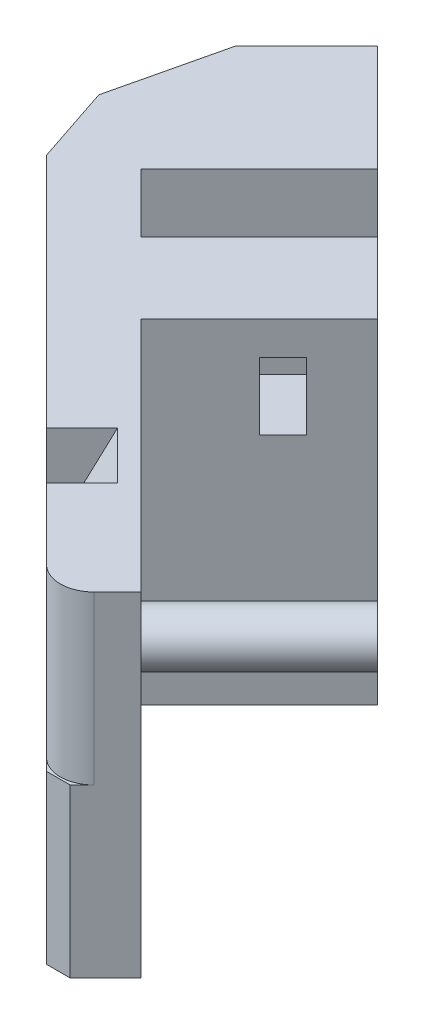
from build123d import *

# Parameters (mm, degrees)
SKICA1_W                 = 200
SKICA1_H                 = 100
P_IDAT_VYSUNUT_M1_DEPTH  = 20
P_IDAT_VYSUNUT_M2_DEPTH  = 50
SKICA7_R                 = 7.5
P_IDAT_VYSUNUT_M3_DEPTH  = 50
ODEBRAT_VYSUNUT_M3_DEPTH = 10
ZAOBLIT1_START           = 50
ZAOBLIT1_DEPTH           = 51
SKICA9_W                 = 40
SKICA9_H                 = 25
ODEBRAT_VYSUNUT_M4_DEPTH = 5
CHAMFER2_SIZE            = 5
FILLET2_DEPTH            = 50
CHAMFER3_SIZE            = 40
CHAMFER3_SIZE2           = 20
CHAMFER4_SIZE            = 20
SKETCH3_R                = 15
CUT_EXTRUDE2_DEPTH       = 60
SKETCH4_W                = 10
SKETCH4_H                = 20
CUT_EXTRUDE3_DEPTH       = 22


with BuildPart() as part:
    # Skica1 → Přidat vysunutím1 (new body)
    with BuildSketch(Plane(origin=(0, 0, 0), x_dir=(-0.7071067811865476, 0, -0.7071067811865476), z_dir=(0.7071067811865476, 0, -0.7071067811865476))):
        with Locations((100, 50)):
            Rectangle(SKICA1_W, SKICA1_H)
    extrude(amount=P_IDAT_VYSUNUT_M1_DEPTH)

    # Skica2 → Přidat vysunutím2 (add)
    with BuildSketch(Plane(origin=(14.142135624, 0, -14.142135624), x_dir=(-0.7071067811865478, 0, -0.7071067811865472), z_dir=(0.7071067811865472, 0, -0.7071067811865478))):
        Polygon((100, 0), (200, 0), (200, 100), (155, 100), (155, 70), (130, 70), (130, 100), (100, 100), align=None)
    extrude(amount=P_IDAT_VYSUNUT_M2_DEPTH)

    # Skica7 → Přidat vysunutím3 (add)
    with BuildSketch(Plane(origin=(14.142135624, 0, -14.142135624), x_dir=(-0.7071067811865478, 0, -0.7071067811865472), z_dir=(0.7071067811865472, 0, -0.7071067811865478))):
        with Locations(Location((12, 80, 0), (0, 0, 180))):
            Circle(SKICA7_R)
    extrude(amount=P_IDAT_VYSUNUT_M3_DEPTH)

    # Skica8 → Odebrat vysunutím3 (cut, symmetric)
    with BuildSketch(Plane(origin=(-35.355339059, 0, -35.355339059), x_dir=(0.7071067811865476, 0, -0.7071067811865475), z_dir=(0.7071067811865475, 0, 0.7071067811865476))):
        Polygon((0, 100), (0, 70), (15, 100), align=None)
    extrude(amount=ODEBRAT_VYSUNUT_M3_DEPTH, both=True, mode=Mode.SUBTRACT)

    # Zaoblit1: read off the stored shape, not the designer's step
    # Zaoblit1 outline → Zaoblit1 (cut)
    with BuildSketch(Plane(origin=(0, 0, 0), x_dir=(1, 0, 0), z_dir=(0, 1, 0)).offset(ZAOBLIT1_START)):
        with BuildLine():
            ThreePointArc((7.071067812, 7.071067812), (0, 4.142135624), (-7.071067812, 7.071067812))
            Line((-7.071067812, 7.071067812), (0, 0))
            Line((0, 0), (7.071067812, 7.071067812))
        make_face()
    extrude(amount=ZAOBLIT1_DEPTH, mode=Mode.SUBTRACT)

    # Skica9 → Odebrat vysunutím4 (cut)
    with BuildSketch(Plane(origin=(0, 0, 0), x_dir=(0.7071067811865478, 0, 0.7071067811865472), z_dir=(-0.7071067811865472, 0, 0.7071067811865478))):
        with Locations((-90, 77.5)):
            Rectangle(SKICA9_W, SKICA9_H)
    extrude(amount=-ODEBRAT_VYSUNUT_M4_DEPTH, mode=Mode.SUBTRACT)

    # Chamfer2
    chamfer2_edges = [part.edges().sort_by_distance(p)[0] for p in [
        (0, 25, 0),
    ]]
    chamfer(chamfer2_edges, length=CHAMFER2_SIZE)

    # Fillet2: read off the stored shape, not the designer's step
    # Fillet2 outline → Fillet2 (cut)
    with BuildSketch(Plane(origin=(0, 0, 0), x_dir=(1, 0, 0), z_dir=(0, 1, 0))):
        with BuildLine():
            Line((-141.421356237, 141.421356237), (-98.994949366, 98.994949366))
            ThreePointArc((-98.994949366, 98.994949366), (-116.568542495, 141.421356238), (-98.994949366, 183.847763109))
            Line((-98.994949366, 183.847763109), (-141.421356237, 141.421356237))
        make_face()
    extrude(amount=FILLET2_DEPTH, mode=Mode.SUBTRACT)

    # Chamfer3
    chamfer3_edges = [part.edges().sort_by_distance(p)[0] for p in [
        (-141.421356237, 75, -141.421356237),
    ]]
    chamfer3_side = [part.faces().sort_by_distance(p)[0] for p in [
        (-65.974510685, 51.38225256, -65.974510685),
    ]]
    chamfer(chamfer3_edges, length=CHAMFER3_SIZE, length2=CHAMFER3_SIZE2, reference=chamfer3_side[0])

    # Chamfer4
    chamfer4_edges = [part.edges().sort_by_distance(p)[0] for p in [
        (-127.279220614, 75, -155.563491861),
    ]]
    chamfer(chamfer4_edges, length=CHAMFER4_SIZE)

    # Sketch2 → Cut-Revolve4 (revolve, cut)
    with BuildSketch(Plane(origin=(0, 0, 0), x_dir=(0.7071067811865478, 0, 0.7071067811865472), z_dir=(-0.7071067811865472, 0, 0.7071067811865478))):
        with BuildLine():
            Line((-50, 35), (-50, 5))
            ThreePointArc((-50, 5), (-35, 20), (-50, 35))
        make_face()
    revolve(axis=Axis((-35.355339059, 35, -35.355339059), (0, -1, 0)), mode=Mode.SUBTRACT)

    # Sketch3 → Cut-Extrude2 (cut)
    with BuildSketch(Plane(origin=(0, 0, 0), x_dir=(0.7071067811865478, 0, 0.7071067811865472), z_dir=(-0.7071067811865472, 0, 0.7071067811865478))):
        with Locations((-120, 20)):
            Circle(SKETCH3_R)
    extrude(amount=-CUT_EXTRUDE2_DEPTH, mode=Mode.SUBTRACT)

    # Sketch4 → Cut-Extrude3 (cut)
    with BuildSketch(Plane(origin=(-70.710678119, 0, -70.710678119), x_dir=(0.7071067811865472, 0, -0.7071067811865478), z_dir=(0.7071067811865478, 0, 0.7071067811865472))):
        with Locations((50, 80)):
            Rectangle(SKETCH4_W, SKETCH4_H)
    extrude(amount=-CUT_EXTRUDE3_DEPTH, mode=Mode.SUBTRACT)


solid = part.part
